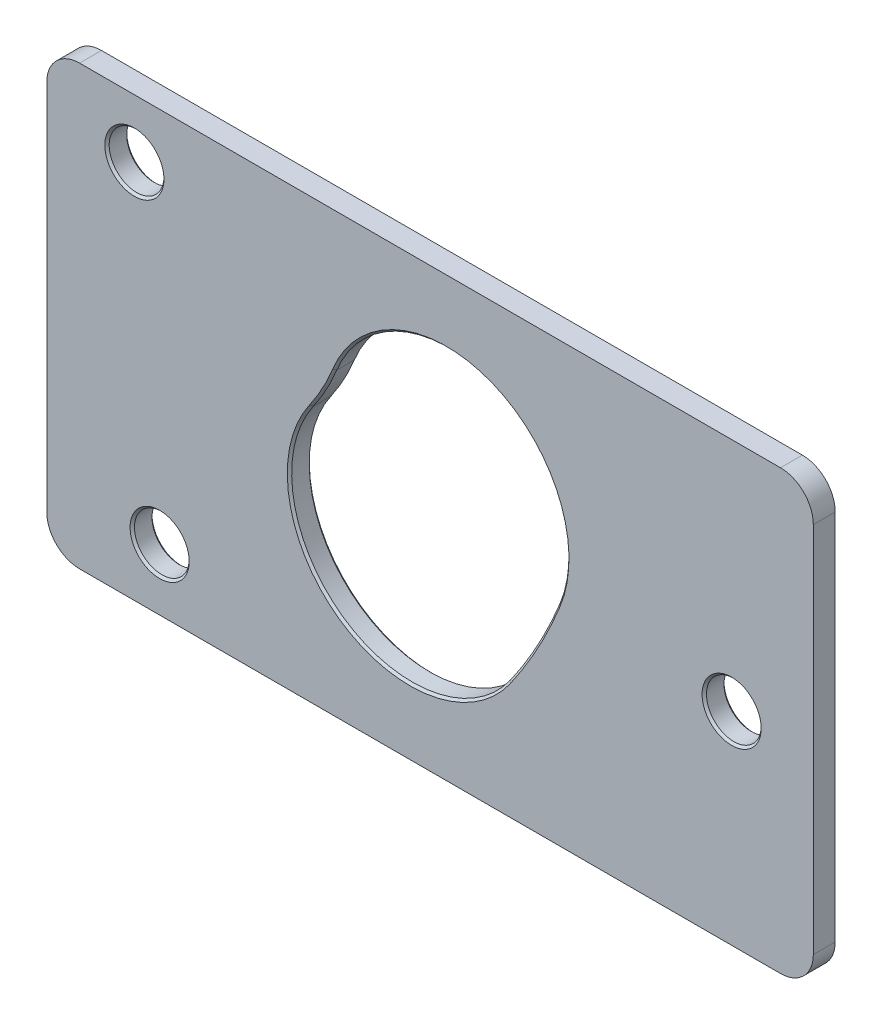
from build123d import *

# Parameters (mm, degrees)
SZKIC2_R                    = 2.5
DODANIE_WYCI_GNI_CIE3_DEPTH = 2
SFAZOWANIE2_SIZE            = 0.2


with BuildPart() as part:
    # Szkic2 → Dodanie-wyciągnięcie3 (new body)
    with BuildSketch(Plane.XY):
        with BuildLine():
            ThreePointArc((-35, -17), (-34.121320344, -19.121320344), (-32, -20))
            Line((-32, -20), (32, -20))
            ThreePointArc((32, -20), (34.121320344, -19.121320344), (35, -17))
            Line((35, -17), (35, 17))
            ThreePointArc((35, 17), (34.121320344, 19.121320344), (32, 20))
            Line((32, 20), (-32, 20))
            ThreePointArc((-32, 20), (-34.121320344, 19.121320344), (-35, 17))
            Line((-35, 17), (-35, -17))
        make_face()
        with Locations((-24.693752651, -14.408678002)):
            Circle(SZKIC2_R, mode=Mode.SUBTRACT)
        with BuildLine():
            ThreePointArc((11.684967283, -0.97190814), (9.665957804, -5.250643745), (7.175560187, -9.273316659))
            ThreePointArc((7.175560187, -9.273316659), (-8.144983036, -11.971641207), (-10.843307584, 3.348902015))
            ThreePointArc((-10.843307584, 3.348902015), (-9.665957804, 5.250643745), (-8.711459473, 7.273440584))
            ThreePointArc((-8.711459473, 7.273440584), (5.609428267, 13.3489796), (11.684967283, -0.97190814))
        make_face(mode=Mode.SUBTRACT)
        with Locations((27.540515543, -1.488970059)):
            Circle(SZKIC2_R, mode=Mode.SUBTRACT)
        with Locations((-27, 14.666666667)):
            Circle(SZKIC2_R, mode=Mode.SUBTRACT)
    extrude(amount=DODANIE_WYCI_GNI_CIE3_DEPTH)

    # Sfazowanie2
    sfazowanie2_edges = [part.edges().sort_by_distance(p)[0] for p in [
        (-27.193752651, -14.408678002, 0),
        (-27.193752651, -14.408678002, 2),
        (25.040515543, -1.488970059, 0),
        (25.040515543, -1.488970059, 2),
        (-9.665957804, 5.250643745, 2),
        (-8.144983036, -11.971641207, 2),
        (-9.665957804, 5.250643745, 0),
        (-8.144983036, -11.971641207, 0),
        (-29.5, 14.666666667, 0),
        (-29.5, 14.666666667, 2),
        (5.609428267, 13.3489796, 2),
        (9.665957804, -5.250643745, 2),
        (5.609428267, 13.3489796, 0),
        (9.665957804, -5.250643745, 0),
    ]]
    chamfer(sfazowanie2_edges, length=SFAZOWANIE2_SIZE)


solid = part.part
